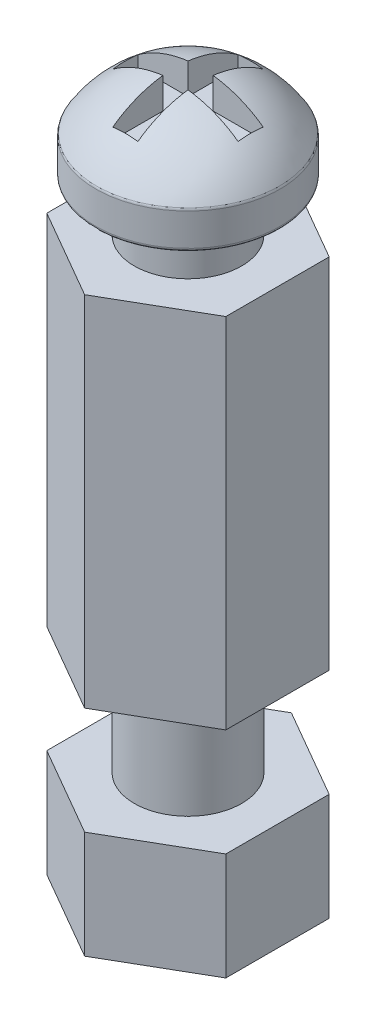
from build123d import *

# Parameters (mm, degrees)
BOSS_EXTRUDE1_DEPTH = 10
SKETCH1_4_R         = 1.5
BOSS_EXTRUDE2_DEPTH = 6
CUT_EXTRUDE1_DEPTH  = 7
FILLET1_R           = 0.1
SKETCH5_R           = 1.5
BOSS_EXTRUDE3_DEPTH = 3


with BuildPart() as part:
    # Sketch1 → Boss-Extrude1 (new body)
    with BuildSketch(Plane(origin=(0, 0, 0), x_dir=(1, 0, 0), z_dir=(0, 1, 0))):
        Polygon((2.5, -1.443375673), (2.5, 1.443375673), (0, 2.886751346), (-2.5, 1.443375673), (-2.5, -1.443375673), (0, -2.886751346), align=None)
    extrude(amount=BOSS_EXTRUDE1_DEPTH)

    # Sketch1<4> → Boss-Extrude2 (add)
    with BuildSketch(Plane(origin=(0, 0, 0), x_dir=(1, 0, 0), z_dir=(0, 1, 0))):
        Circle(SKETCH1_4_R)
    extrude(amount=-BOSS_EXTRUDE2_DEPTH)

    # Sketch3 → Revolve1 (revolve)
    with BuildSketch(Plane.XY):
        with BuildLine():
            Line((0, 10), (1.5, 10))
            Line((1.5, 10), (1.5, 11.4))
            Line((1.5, 11.4), (2.577677109, 11.4))
            Line((2.577677109, 11.4), (2.577677109, 12.4))
            ThreePointArc((2.577677109, 12.4), (2.572999108, 12.43387649), (2.559315243, 12.465217392))
            ThreePointArc((2.559315243, 12.465217392), (1.46702894, 13.516835128), (0, 13.9))
            Line((0, 13.9), (0, 10))
        make_face()
    revolve(axis=Axis((0, 10, 0), (0, -1, 0)))

    # Sketch4 → Cut-Extrude1 (cut)
    with BuildSketch(Plane(origin=(0, 20, 0), x_dir=(1, 0, 0), z_dir=(0, 1, 0))):
        Polygon((-1.75, 0.35), (-1.75, -0.35), (-0.35, -0.35), (-0.35, -1.75), (0.35, -1.75), (0.35, -0.35), (1.75, -0.35), (1.75, 0.35), (0.35, 0.35), (0.35, 1.75), (-0.35, 1.75), (-0.35, 0.35), align=None)
    extrude(amount=-CUT_EXTRUDE1_DEPTH, mode=Mode.SUBTRACT)

    # Fillet1
    fillet1_edges = [part.edges().sort_by_distance(p)[0] for p in [
        (-2.577677109, 11.4, 0),
    ]]
    fillet(fillet1_edges, radius=FILLET1_R)


with BuildPart() as body_2:
    # Sketch5 → Boss-Extrude3 (new body)
    with BuildSketch(Plane.XZ.offset(6)):
        Polygon((2.5, 1.443375673), (0, 2.886751346), (-2.5, 1.443375673), (-2.5, -1.443375673), (0, -2.886751346), (2.5, -1.443375673), align=None)
        Circle(SKETCH5_R, mode=Mode.SUBTRACT)
    extrude(amount=-BOSS_EXTRUDE3_DEPTH)


solid = Compound([part.part, body_2.part])
